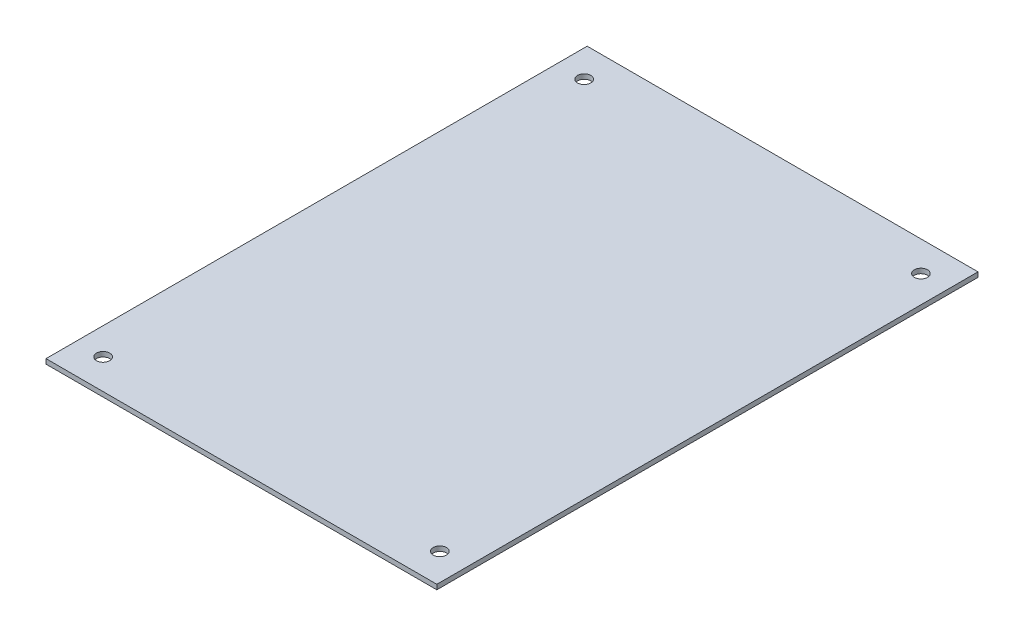
from build123d import *

# Parameters (mm, degrees)
SKETCH1_R           = 1.1
BOSS_EXTRUDE1_DEPTH = 0.8


with BuildPart() as part:
    # Sketch1 → Boss-Extrude1 (new body)
    with BuildSketch(Plane(origin=(0, 0, 0), x_dir=(1, 0, 0), z_dir=(0, 1, 0))):
        Polygon((0, 45), (0, 0), (32.5, 0), (65, 0), (65, 90), (0, 90), align=None)
        with Locations((4.5, 5)):
            Circle(SKETCH1_R, mode=Mode.SUBTRACT)
        with Locations((60.5, 5)):
            Circle(SKETCH1_R, mode=Mode.SUBTRACT)
        with Locations((4.5, 85)):
            Circle(SKETCH1_R, mode=Mode.SUBTRACT)
        with Locations((60.5, 85)):
            Circle(SKETCH1_R, mode=Mode.SUBTRACT)
    extrude(amount=BOSS_EXTRUDE1_DEPTH)


solid = part.part
